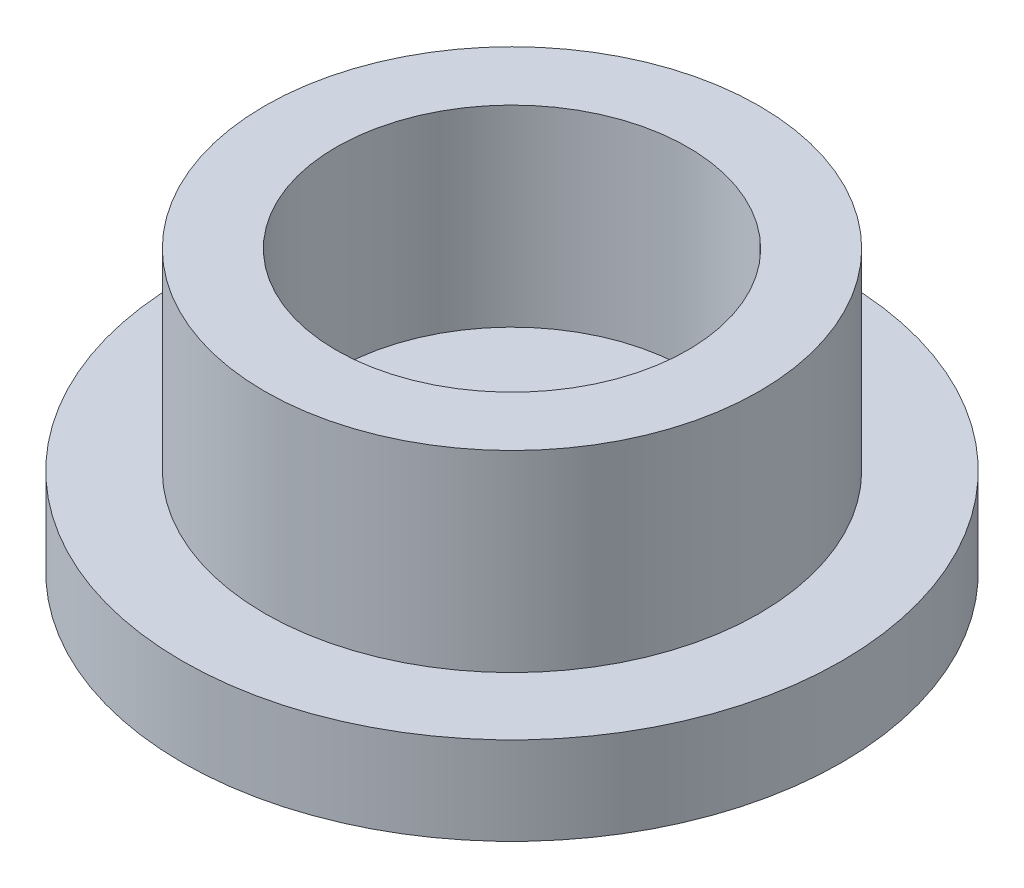
from build123d import *

# Parameters (mm, degrees)
SKETCH1_R           = 2.25
SKETCH1_R_2         = 1.6
BOSS_EXTRUDE1_DEPTH = 1.75
SKETCH2_R           = 3
BOSS_EXTRUDE2_DEPTH = 0.8


with BuildPart() as part:
    # Sketch1 → Boss-Extrude1 (new body)
    with BuildSketch(Plane(origin=(0, 0, 0), x_dir=(1, 0, 0), z_dir=(0, 1, 0))):
        Circle(SKETCH1_R)
        Circle(SKETCH1_R_2, mode=Mode.SUBTRACT)
    extrude(amount=BOSS_EXTRUDE1_DEPTH)

    # Sketch2 → Boss-Extrude2 (add)
    with BuildSketch(Plane.XZ):
        Circle(SKETCH2_R)
    extrude(amount=BOSS_EXTRUDE2_DEPTH)


solid = part.part
